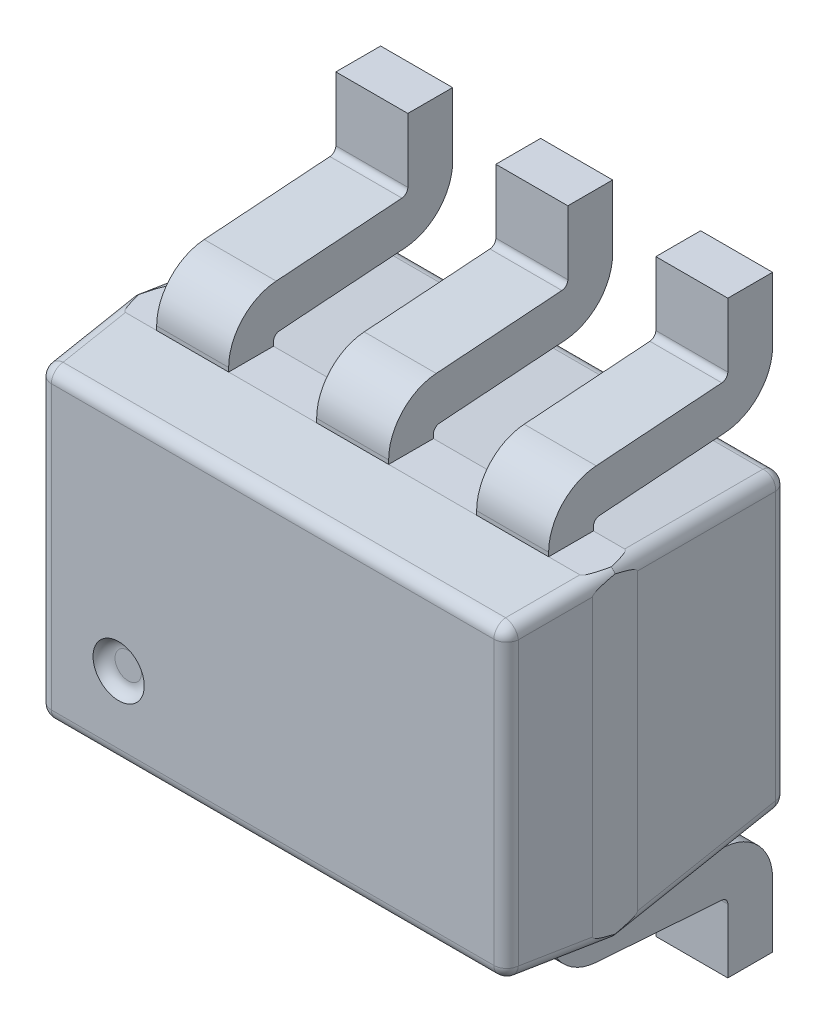
from build123d import *
from OCP.BRepFilletAPI import BRepFilletAPI_MakeChamfer

# Parameters (mm, degrees)
SALIENTE_EXTRUIR1_START = 0.05
CROQUIS1_W              = 1.5
CROQUIS1_H              = 1
SALIENTE_EXTRUIR1_DEPTH = 0.51
CHAFL_N1_SIZE           = 0.51
CHAFL_N1_SIZE_2         = 0.044619218
CROQUIS2_W              = 1.5
CROQUIS2_H              = 1
SALIENTE_EXTRUIR2_DEPTH = 0.39
CHAFL_N2_SIZE           = 0.25
CHAFL_N2_SIZE2          = 0.021872166
REDONDEO1_R             = 0.04
EXTRUIR_L_MINA1_DEPTH   = 0.1125
MATRIZL2_COUNT          = 2
MATRIZL2_PITCH          = 0.5
MATRIZL2_COL_COUNT      = 2
MATRIZL2_COL_PITCH      = 0.5
SIMETR_A2_COPY_1_DEPTH  = 0.1125
SIMETR_A2_COPY_2_DEPTH  = 0.1125
CROQUIS7_W              = 0.7
CROQUIS7_H              = 0.42
CORTAR_EXTRUIR1_DEPTH   = 0.225
CROQUIS8_R              = 0.08
CORTAR_EXTRUIR3_DEPTH   = 0.03
REDONDEO2_R             = 0.04


with BuildPart() as part:
    # Croquis1 → Saliente-Extruir1 (new body)
    with BuildSketch(Plane.XY.offset(SALIENTE_EXTRUIR1_START)):
        Rectangle(CROQUIS1_W, CROQUIS1_H)
    extrude(amount=SALIENTE_EXTRUIR1_DEPTH)

    # Chaflán1
    # the kernel refuses this chamfer: 0.51, 0.044619218 mm, written as the material it takes off along each edge
    with BuildSketch(Plane(origin=(2.075813381, 0.5, 0.05), x_dir=(0, 0, 1), z_dir=(-1, 0, 0)), Plane(origin=(-2.075813381, -0.5, 0.05), x_dir=(0, 0, 1), z_dir=(1, 0, 0))) as chafl_n1_piece_1:
        Polygon((CHAFL_N1_SIZE, 0), (0, -CHAFL_N1_SIZE_2 * 1.00000000892), (0, 0), align=None)
    extrude(amount=4.151626761, mode=Mode.SUBTRACT)
    with BuildSketch(Plane(origin=(-0.75, 1.825813381, 0.05), x_dir=(0, 0, 1), z_dir=(0, -1, 0)), Plane(origin=(0.75, -1.825813381, 0.05), x_dir=(0, 0, 1), z_dir=(0, 1, 0))) as chafl_n1_piece_2:
        Polygon((CHAFL_N1_SIZE, 0), (0, -CHAFL_N1_SIZE_2 * 1.00000000892), (0, 0), align=None)
    extrude(amount=3.651626761, mode=Mode.SUBTRACT)

    # Croquis2 → Saliente-Extruir2 (add)
    with BuildSketch(Plane.XY.offset(0.56)):
        Rectangle(CROQUIS2_W, CROQUIS2_H)
    extrude(amount=SALIENTE_EXTRUIR2_DEPTH)

    # Chaflán2: one chamfer whose edges measure the first distance from different faces: ONE call of the kernel's chamfer builder (chamfer() names one face for all edges)
    chafl_n2_edges_1 = [part.edges().sort_by_distance(p)[0] for p in [
        (0.75, 0, 0.95),
    ]]
    chafl_n2_side_1 = [part.faces().sort_by_distance(p)[0] for p in [
        (0.75, 0, 0.755),
    ]]
    chafl_n2_edges_2 = [part.edges().sort_by_distance(p)[0] for p in [
        (0, 0.5, 0.95),
    ]]
    chafl_n2_side_2 = [part.faces().sort_by_distance(p)[0] for p in [
        (0, 0.5, 0.755),
    ]]
    chafl_n2_edges_3 = [part.edges().sort_by_distance(p)[0] for p in [
        (-0.75, 0, 0.95),
    ]]
    chafl_n2_side_3 = [part.faces().sort_by_distance(p)[0] for p in [
        (-0.75, 0, 0.755),
    ]]
    chafl_n2_edges_4 = [part.edges().sort_by_distance(p)[0] for p in [
        (0, -0.5, 0.95),
    ]]
    chafl_n2_side_4 = [part.faces().sort_by_distance(p)[0] for p in [
        (0, -0.5, 0.755),
    ]]
    chafl_n2 = BRepFilletAPI_MakeChamfer(part.part.solid().wrapped)
    for e in chafl_n2_edges_1:
        chafl_n2.Add(CHAFL_N2_SIZE, CHAFL_N2_SIZE2, e.wrapped, chafl_n2_side_1[0].wrapped)  # the first distance lies on this face
    for e in chafl_n2_edges_2:
        chafl_n2.Add(CHAFL_N2_SIZE, CHAFL_N2_SIZE2, e.wrapped, chafl_n2_side_2[0].wrapped)  # the first distance lies on this face
    for e in chafl_n2_edges_3:
        chafl_n2.Add(CHAFL_N2_SIZE, CHAFL_N2_SIZE2, e.wrapped, chafl_n2_side_3[0].wrapped)  # the first distance lies on this face
    for e in chafl_n2_edges_4:
        chafl_n2.Add(CHAFL_N2_SIZE, CHAFL_N2_SIZE2, e.wrapped, chafl_n2_side_4[0].wrapped)  # the first distance lies on this face
    add(Compound.cast(chafl_n2.Shape()), mode=Mode.REPLACE)

    # Redondeo1
    # the kernel refuses this fillet: 0.04 mm, written as the material it takes off along each edge
    with BuildSketch(Plane(origin=(0.668727535, 0.418727535, 0.09), x_dir=(-0.7071067811865475, 0.7071067811865475, 0), z_dir=(0.5431604763461051, 0.5431604763461051, -0.6402760294364802))) as redondeo1_piece_1_section:
        Polygon((-0.0785695, -0.0785695), (0.0785695, -0.0785695), (0.0785695, 0.0785695), (-0.0785695, 0.0785695), align=None)
    redondeo1_piece_1 = extrude(amount=0.0785695, mode=Mode.PRIVATE)
    redondeo1_piece_1 = split(redondeo1_piece_1, bisect_by=Plane(origin=(0.668727535, 0.418727535, 0.09), z_dir=(0, 1, 0)), keep=Keep.TOP, mode=Mode.PRIVATE)
    redondeo1_piece_1 = split(redondeo1_piece_1, bisect_by=Plane(origin=(0.668727535, 0.418727535, 0.09), z_dir=(-0.08682659386383014, -0.08682659386383014, -0.9924325091390401)), keep=Keep.TOP, mode=Mode.PRIVATE)
    redondeo1_piece_1 = split(redondeo1_piece_1, bisect_by=Plane(origin=(0.668727535, 0.418727535, 0.09), z_dir=(1, 0, 0)), keep=Keep.TOP, mode=Mode.PRIVATE)
    redondeo1_piece_1 = split(redondeo1_piece_1, bisect_by=Plane(origin=(0.668727535, 0.418727535, 0.05), z_dir=(0, 0, 1)), keep=Keep.TOP, mode=Mode.PRIVATE)
    redondeo1_piece_1 = split(redondeo1_piece_1, bisect_by=Plane(origin=(0.708575323, 0.418727535, 0.08651377), z_dir=(-0.9961946980917825, 0, 0.08715574274723596)), keep=Keep.TOP, mode=Mode.PRIVATE)
    redondeo1_piece_1 = split(redondeo1_piece_1, bisect_by=Plane(origin=(0.668727535, 0.458575323, 0.08651377), z_dir=(0, -0.9961946980917825, 0.08715574274723596)), keep=Keep.TOP, mode=Mode.PRIVATE)
    redondeo1_piece_1 = redondeo1_piece_1 - Plane(origin=(0.668727535, 0.418727535, 0.09), x_dir=(-0.5431604763461051, -0.5431604763461051, 0.6402760294364802), z_dir=(-0.7071067811865475, 0.7071067811865475, 0)) * Sphere(REDONDEO1_R, mode=Mode.PRIVATE)
    add(redondeo1_piece_1, mode=Mode.SUBTRACT)
    with BuildSketch(Plane(origin=(-0.668727535, 0.418727535, 0.09), x_dir=(-0.7071067811865475, -0.7071067811865475, 0), z_dir=(-0.5431604763461051, 0.5431604763461051, -0.6402760294364802))) as redondeo1_piece_2_section:
        Polygon((-0.0785695, -0.0785695), (0.0785695, -0.0785695), (0.0785695, 0.0785695), (-0.0785695, 0.0785695), align=None)
    redondeo1_piece_2 = extrude(amount=0.0785695, mode=Mode.PRIVATE)
    redondeo1_piece_2 = split(redondeo1_piece_2, bisect_by=Plane(origin=(-0.668727535, 0.418727535, 0.09), z_dir=(-1, 0, 0)), keep=Keep.TOP, mode=Mode.PRIVATE)
    redondeo1_piece_2 = split(redondeo1_piece_2, bisect_by=Plane(origin=(-0.668727535, 0.418727535, 0.09), z_dir=(0.08682659386383014, -0.08682659386383014, -0.9924325091390401)), keep=Keep.TOP, mode=Mode.PRIVATE)
    redondeo1_piece_2 = split(redondeo1_piece_2, bisect_by=Plane(origin=(-0.668727535, 0.418727535, 0.09), z_dir=(0, 1, 0)), keep=Keep.TOP, mode=Mode.PRIVATE)
    redondeo1_piece_2 = split(redondeo1_piece_2, bisect_by=Plane(origin=(-0.668727535, 0.418727535, 0.05), z_dir=(0, 0, 1)), keep=Keep.TOP, mode=Mode.PRIVATE)
    redondeo1_piece_2 = split(redondeo1_piece_2, bisect_by=Plane(origin=(-0.668727535, 0.458575323, 0.08651377), z_dir=(0, -0.9961946980917825, 0.08715574274723596)), keep=Keep.TOP, mode=Mode.PRIVATE)
    redondeo1_piece_2 = split(redondeo1_piece_2, bisect_by=Plane(origin=(-0.708575323, 0.418727535, 0.08651377), z_dir=(0.9961946980917825, 0, 0.08715574274723596)), keep=Keep.TOP, mode=Mode.PRIVATE)
    redondeo1_piece_2 = redondeo1_piece_2 - Plane(origin=(-0.668727535, 0.418727535, 0.09), x_dir=(0.5431604763461051, -0.5431604763461051, 0.6402760294364802), z_dir=(-0.7071067811865475, -0.7071067811865475, 0)) * Sphere(REDONDEO1_R, mode=Mode.PRIVATE)
    add(redondeo1_piece_2, mode=Mode.SUBTRACT)
    with BuildSketch(Plane(origin=(-0.668727535, -0.418727535, 0.09), x_dir=(0.7071067811865475, -0.7071067811865475, 0), z_dir=(-0.5431604763461051, -0.5431604763461051, -0.6402760294364802))) as redondeo1_piece_3_section:
        Polygon((-0.0785695, -0.0785695), (0.0785695, -0.0785695), (0.0785695, 0.0785695), (-0.0785695, 0.0785695), align=None)
    redondeo1_piece_3 = extrude(amount=0.0785695, mode=Mode.PRIVATE)
    redondeo1_piece_3 = split(redondeo1_piece_3, bisect_by=Plane(origin=(-0.668727535, -0.418727535, 0.09), z_dir=(-1, 0, 0)), keep=Keep.TOP, mode=Mode.PRIVATE)
    redondeo1_piece_3 = split(redondeo1_piece_3, bisect_by=Plane(origin=(-0.668727535, -0.418727535, 0.09), z_dir=(0.08682659386383014, 0.08682659386383014, -0.9924325091390401)), keep=Keep.TOP, mode=Mode.PRIVATE)
    redondeo1_piece_3 = split(redondeo1_piece_3, bisect_by=Plane(origin=(-0.668727535, -0.418727535, 0.09), z_dir=(0, -1, 0)), keep=Keep.TOP, mode=Mode.PRIVATE)
    redondeo1_piece_3 = split(redondeo1_piece_3, bisect_by=Plane(origin=(-0.668727535, -0.418727535, 0.05), z_dir=(0, 0, 1)), keep=Keep.TOP, mode=Mode.PRIVATE)
    redondeo1_piece_3 = split(redondeo1_piece_3, bisect_by=Plane(origin=(-0.668727535, -0.458575323, 0.08651377), z_dir=(0, 0.9961946980917825, 0.08715574274723596)), keep=Keep.TOP, mode=Mode.PRIVATE)
    redondeo1_piece_3 = split(redondeo1_piece_3, bisect_by=Plane(origin=(-0.708575323, -0.418727535, 0.08651377), z_dir=(0.9961946980917825, 0, 0.08715574274723596)), keep=Keep.TOP, mode=Mode.PRIVATE)
    redondeo1_piece_3 = redondeo1_piece_3 - Plane(origin=(-0.668727535, -0.418727535, 0.09), x_dir=(0.5431604763461051, 0.5431604763461051, 0.6402760294364802), z_dir=(0.7071067811865475, -0.7071067811865475, 0)) * Sphere(REDONDEO1_R, mode=Mode.PRIVATE)
    add(redondeo1_piece_3, mode=Mode.SUBTRACT)
    with BuildSketch(Plane(origin=(0.668727535, -0.418727535, 0.09), x_dir=(0.05900350758257069, -0.7359928340769734, 0.6744131777184507), z_dir=(0.5431604763461051, -0.5431604763461051, -0.6402760294364802))) as redondeo1_piece_4_section:
        Polygon((-0.0785695, -0.0785695), (0.0785695, -0.0785695), (0.0785695, 0.0785695), (-0.0785695, 0.0785695), align=None)
    redondeo1_piece_4 = extrude(amount=0.0785695, mode=Mode.PRIVATE)
    redondeo1_piece_4 = split(redondeo1_piece_4, bisect_by=Plane(origin=(0.668727535, -0.418727535, 0.09), z_dir=(0, -1, 0)), keep=Keep.TOP, mode=Mode.PRIVATE)
    redondeo1_piece_4 = split(redondeo1_piece_4, bisect_by=Plane(origin=(0.668727535, -0.418727535, 0.09), z_dir=(1, 0, 0)), keep=Keep.TOP, mode=Mode.PRIVATE)
    redondeo1_piece_4 = split(redondeo1_piece_4, bisect_by=Plane(origin=(0.668727535, -0.418727535, 0.09), z_dir=(-0.08682659386383014, 0.08682659386383014, -0.9924325091390401)), keep=Keep.TOP, mode=Mode.PRIVATE)
    redondeo1_piece_4 = split(redondeo1_piece_4, bisect_by=Plane(origin=(0.708575323, -0.418727535, 0.08651377), z_dir=(-0.9961946980917825, 0, 0.08715574274723596)), keep=Keep.TOP, mode=Mode.PRIVATE)
    redondeo1_piece_4 = split(redondeo1_piece_4, bisect_by=Plane(origin=(0.668727535, -0.418727535, 0.05), z_dir=(0, 0, 1)), keep=Keep.TOP, mode=Mode.PRIVATE)
    redondeo1_piece_4 = split(redondeo1_piece_4, bisect_by=Plane(origin=(0.668727535, -0.458575323, 0.08651377), z_dir=(0, 0.9961946980917825, 0.08715574274723596)), keep=Keep.TOP, mode=Mode.PRIVATE)
    redondeo1_piece_4 = redondeo1_piece_4 - Plane(origin=(0.668727535, -0.418727535, 0.09), x_dir=(-0.5431604763461051, 0.5431604763461051, 0.6402760294364802), z_dir=(0.05900350758257069, -0.7359928340769734, 0.6744131777184507)) * Sphere(REDONDEO1_R, mode=Mode.PRIVATE)
    add(redondeo1_piece_4, mode=Mode.SUBTRACT)
    with BuildSketch(Plane(origin=(0.691474587, -0.441474587, 0.91), x_dir=(-0.7071067811865476, -0.7071067811865476, 0), z_dir=(0.5431604763459367, -0.5431604763459367, 0.640276029436766))) as redondeo1_piece_5_section:
        Polygon((-0.0785695, -0.0785695), (0.0785695, -0.0785695), (0.0785695, 0.0785695), (-0.0785695, 0.0785695), align=None)
    redondeo1_piece_5 = extrude(amount=0.0785695, mode=Mode.PRIVATE)
    redondeo1_piece_5 = split(redondeo1_piece_5, bisect_by=Plane(origin=(0.691474587, -0.441474587, 0.91), z_dir=(0, -1, 0)), keep=Keep.TOP, mode=Mode.PRIVATE)
    redondeo1_piece_5 = split(redondeo1_piece_5, bisect_by=Plane(origin=(0.691474587, -0.441474587, 0.91), z_dir=(-0.08682659386424758, 0.0868265938642478, 0.9924325091389671)), keep=Keep.TOP, mode=Mode.PRIVATE)
    redondeo1_piece_5 = split(redondeo1_piece_5, bisect_by=Plane(origin=(0.691474587, -0.441474587, 0.91), z_dir=(1, 0, 0)), keep=Keep.TOP, mode=Mode.PRIVATE)
    redondeo1_piece_5 = split(redondeo1_piece_5, bisect_by=Plane(origin=(0.691474587, -0.441474587, 0.95), z_dir=(0, 0, -1)), keep=Keep.TOP, mode=Mode.PRIVATE)
    redondeo1_piece_5 = split(redondeo1_piece_5, bisect_by=Plane(origin=(0.731322375, -0.441474587, 0.91348623), z_dir=(-0.9961946980917455, 0, -0.08715574274765817)), keep=Keep.TOP, mode=Mode.PRIVATE)
    redondeo1_piece_5 = split(redondeo1_piece_5, bisect_by=Plane(origin=(0.691474587, -0.481322375, 0.91348623), z_dir=(0, 0.9961946980917455, -0.08715574274765839)), keep=Keep.TOP, mode=Mode.PRIVATE)
    redondeo1_piece_5 = redondeo1_piece_5 - Plane(origin=(0.691474587, -0.441474587, 0.91), x_dir=(-0.5431604763459367, 0.5431604763459367, -0.640276029436766), z_dir=(-0.7071067811865476, -0.7071067811865476, 0)) * Sphere(REDONDEO1_R, mode=Mode.PRIVATE)
    add(redondeo1_piece_5, mode=Mode.SUBTRACT)
    with BuildSketch(Plane(origin=(0.691474587, 0.441474587, 0.91), x_dir=(0.7071067811865476, -0.7071067811865476, 0), z_dir=(0.5431604763459367, 0.5431604763459367, 0.640276029436766))) as redondeo1_piece_6_section:
        Polygon((-0.0785695, -0.0785695), (0.0785695, -0.0785695), (0.0785695, 0.0785695), (-0.0785695, 0.0785695), align=None)
    redondeo1_piece_6 = extrude(amount=0.0785695, mode=Mode.PRIVATE)
    redondeo1_piece_6 = split(redondeo1_piece_6, bisect_by=Plane(origin=(0.691474587, 0.441474587, 0.91), z_dir=(0, 1, 0)), keep=Keep.TOP, mode=Mode.PRIVATE)
    redondeo1_piece_6 = split(redondeo1_piece_6, bisect_by=Plane(origin=(0.691474587, 0.441474587, 0.91), z_dir=(-0.08682659386424758, -0.0868265938642478, 0.9924325091389671)), keep=Keep.TOP, mode=Mode.PRIVATE)
    redondeo1_piece_6 = split(redondeo1_piece_6, bisect_by=Plane(origin=(0.691474587, 0.441474587, 0.91), z_dir=(1, 0, 0)), keep=Keep.TOP, mode=Mode.PRIVATE)
    redondeo1_piece_6 = split(redondeo1_piece_6, bisect_by=Plane(origin=(0.691474587, 0.441474587, 0.95), z_dir=(0, 0, -1)), keep=Keep.TOP, mode=Mode.PRIVATE)
    redondeo1_piece_6 = split(redondeo1_piece_6, bisect_by=Plane(origin=(0.731322375, 0.441474587, 0.91348623), z_dir=(-0.9961946980917455, 0, -0.08715574274765817)), keep=Keep.TOP, mode=Mode.PRIVATE)
    redondeo1_piece_6 = split(redondeo1_piece_6, bisect_by=Plane(origin=(0.691474587, 0.481322375, 0.91348623), z_dir=(0, -0.9961946980917455, -0.08715574274765839)), keep=Keep.TOP, mode=Mode.PRIVATE)
    redondeo1_piece_6 = redondeo1_piece_6 - Plane(origin=(0.691474587, 0.441474587, 0.91), x_dir=(-0.5431604763459367, -0.5431604763459367, -0.640276029436766), z_dir=(0.7071067811865476, -0.7071067811865476, 0)) * Sphere(REDONDEO1_R, mode=Mode.PRIVATE)
    add(redondeo1_piece_6, mode=Mode.SUBTRACT)
    with BuildSketch(Plane(origin=(-0.691474587, -0.441474587, 0.91), x_dir=(-0.7071067811865476, 0.7071067811865476, 0), z_dir=(-0.5431604763459367, -0.5431604763459367, 0.640276029436766))) as redondeo1_piece_7_section:
        Polygon((-0.0785695, -0.0785695), (0.0785695, -0.0785695), (0.0785695, 0.0785695), (-0.0785695, 0.0785695), align=None)
    redondeo1_piece_7 = extrude(amount=0.0785695, mode=Mode.PRIVATE)
    redondeo1_piece_7 = split(redondeo1_piece_7, bisect_by=Plane(origin=(-0.691474587, -0.441474587, 0.91), z_dir=(-1, 0, 0)), keep=Keep.TOP, mode=Mode.PRIVATE)
    redondeo1_piece_7 = split(redondeo1_piece_7, bisect_by=Plane(origin=(-0.691474587, -0.441474587, 0.91), z_dir=(0.08682659386424758, 0.0868265938642478, 0.9924325091389671)), keep=Keep.TOP, mode=Mode.PRIVATE)
    redondeo1_piece_7 = split(redondeo1_piece_7, bisect_by=Plane(origin=(-0.691474587, -0.441474587, 0.91), z_dir=(0, -1, 0)), keep=Keep.TOP, mode=Mode.PRIVATE)
    redondeo1_piece_7 = split(redondeo1_piece_7, bisect_by=Plane(origin=(-0.691474587, -0.441474587, 0.95), z_dir=(0, 0, -1)), keep=Keep.TOP, mode=Mode.PRIVATE)
    redondeo1_piece_7 = split(redondeo1_piece_7, bisect_by=Plane(origin=(-0.691474587, -0.481322375, 0.91348623), z_dir=(0, 0.9961946980917455, -0.08715574274765839)), keep=Keep.TOP, mode=Mode.PRIVATE)
    redondeo1_piece_7 = split(redondeo1_piece_7, bisect_by=Plane(origin=(-0.731322375, -0.441474587, 0.91348623), z_dir=(0.9961946980917455, 0, -0.08715574274765817)), keep=Keep.TOP, mode=Mode.PRIVATE)
    redondeo1_piece_7 = redondeo1_piece_7 - Plane(origin=(-0.691474587, -0.441474587, 0.91), x_dir=(0.5431604763459367, 0.5431604763459367, -0.640276029436766), z_dir=(-0.7071067811865476, 0.7071067811865476, 0)) * Sphere(REDONDEO1_R, mode=Mode.PRIVATE)
    add(redondeo1_piece_7, mode=Mode.SUBTRACT)
    with BuildSketch(Plane(origin=(-0.691474587, 0.441474587, 0.91), x_dir=(0.7071067811865476, 0.7071067811865476, 0), z_dir=(-0.5431604763459367, 0.5431604763459367, 0.640276029436766))) as redondeo1_piece_8_section:
        Polygon((-0.0785695, -0.0785695), (0.0785695, -0.0785695), (0.0785695, 0.0785695), (-0.0785695, 0.0785695), align=None)
    redondeo1_piece_8 = extrude(amount=0.0785695, mode=Mode.PRIVATE)
    redondeo1_piece_8 = split(redondeo1_piece_8, bisect_by=Plane(origin=(-0.691474587, 0.441474587, 0.91), z_dir=(-1, 0, 0)), keep=Keep.TOP, mode=Mode.PRIVATE)
    redondeo1_piece_8 = split(redondeo1_piece_8, bisect_by=Plane(origin=(-0.691474587, 0.441474587, 0.91), z_dir=(0.08682659386424758, -0.0868265938642478, 0.9924325091389671)), keep=Keep.TOP, mode=Mode.PRIVATE)
    redondeo1_piece_8 = split(redondeo1_piece_8, bisect_by=Plane(origin=(-0.691474587, 0.441474587, 0.91), z_dir=(0, 1, 0)), keep=Keep.TOP, mode=Mode.PRIVATE)
    redondeo1_piece_8 = split(redondeo1_piece_8, bisect_by=Plane(origin=(-0.691474587, 0.441474587, 0.95), z_dir=(0, 0, -1)), keep=Keep.TOP, mode=Mode.PRIVATE)
    redondeo1_piece_8 = split(redondeo1_piece_8, bisect_by=Plane(origin=(-0.691474587, 0.481322375, 0.91348623), z_dir=(0, -0.9961946980917455, -0.08715574274765839)), keep=Keep.TOP, mode=Mode.PRIVATE)
    redondeo1_piece_8 = split(redondeo1_piece_8, bisect_by=Plane(origin=(-0.731322375, 0.441474587, 0.91348623), z_dir=(0.9961946980917455, 0, -0.08715574274765817)), keep=Keep.TOP, mode=Mode.PRIVATE)
    redondeo1_piece_8 = redondeo1_piece_8 - Plane(origin=(-0.691474587, 0.441474587, 0.91), x_dir=(0.5431604763459367, -0.5431604763459367, -0.640276029436766), z_dir=(0.7071067811865476, 0.7071067811865476, 0)) * Sphere(REDONDEO1_R, mode=Mode.PRIVATE)
    add(redondeo1_piece_8, mode=Mode.SUBTRACT)
    with BuildSketch(Plane(origin=(0.668727535, 0.455380782, 0.05), x_dir=(0, -1, 0), z_dir=(-1, 0, 0))) as redondeo1_piece_9:
        with BuildLine():
            CenterArc((REDONDEO1_R * 0.916331174018, REDONDEO1_R), REDONDEO1_R, 185, 85)
            Line((-REDONDEO1_R * 0.079863524074, REDONDEO1_R * 0.912844257253), (0, 0))
            Line((0, 0), (REDONDEO1_R * 0.916331174018, 0))
        make_face()
    extrude(amount=1.337455069, mode=Mode.SUBTRACT)
    with BuildSketch(Plane(origin=(-0.705380782, 0.418727535, 0.05), x_dir=(-0.08715574274723663, 0, 0.9961946980917824), z_dir=(0, -1, 0))) as redondeo1_piece_10:
        with BuildLine():
            CenterArc((REDONDEO1_R * 0.916331174018, -REDONDEO1_R), REDONDEO1_R, 90, 85)
            Line((-REDONDEO1_R * 0.079863524074, -REDONDEO1_R * 0.912844257253), (0, 0))
            Line((0, 0), (REDONDEO1_R * 0.916331174018, 0))
        make_face()
    extrude(amount=0.837455069, mode=Mode.SUBTRACT)
    with BuildSketch(Plane(origin=(-0.668727535, -0.455380782, 0.05), x_dir=(0, -0.08715574274723376, 0.9961946980917826), z_dir=(1, 0, 0))) as redondeo1_piece_11:
        with BuildLine():
            CenterArc((REDONDEO1_R * 0.916331174018, -REDONDEO1_R), REDONDEO1_R, 90, 85)
            Line((-REDONDEO1_R * 0.079863524074, -REDONDEO1_R * 0.912844257253), (0, 0))
            Line((0, 0), (REDONDEO1_R * 0.916331174018, 0))
        make_face()
    extrude(amount=1.337455069, mode=Mode.SUBTRACT)
    with BuildSketch(Plane(origin=(0.705380782, -0.418727535, 0.05), x_dir=(-1, 0, 0), z_dir=(0, 1, 0))) as redondeo1_piece_12:
        with BuildLine():
            CenterArc((REDONDEO1_R * 0.916331174018, REDONDEO1_R), REDONDEO1_R, 185, 85)
            Line((-REDONDEO1_R * 0.079863524074, REDONDEO1_R * 0.912844257253), (0, 0))
            Line((0, 0), (REDONDEO1_R * 0.916331174018, 0))
        make_face()
    extrude(amount=0.837455069, mode=Mode.SUBTRACT)
    with BuildSketch(Plane(origin=(0.728127834, -0.441474587, 0.95), x_dir=(-1, 0, 0), z_dir=(0, 1, 0))) as redondeo1_piece_13:
        with BuildLine():
            CenterArc((REDONDEO1_R * 0.916331174017, -REDONDEO1_R), REDONDEO1_R, 90, 85)
            Line((-REDONDEO1_R * 0.0798635240743, -REDONDEO1_R * 0.912844257252), (0, 0))
            Line((0, 0), (REDONDEO1_R * 0.916331174017, 0))
        make_face()
    extrude(amount=0.882949174, mode=Mode.SUBTRACT)
    with BuildSketch(Plane(origin=(-0.691474587, -0.478127834, 0.95), x_dir=(0, -0.08715574274765722, -0.9961946980917455), z_dir=(1, 0, 0))) as redondeo1_piece_14:
        with BuildLine():
            CenterArc((REDONDEO1_R * 0.916331174017, REDONDEO1_R), REDONDEO1_R, 185, 85)
            Line((-REDONDEO1_R * 0.0798635240743, REDONDEO1_R * 0.912844257252), (0, 0))
            Line((0, 0), (REDONDEO1_R * 0.916331174017, 0))
        make_face()
    extrude(amount=1.382949174, mode=Mode.SUBTRACT)
    with BuildSketch(Plane(origin=(-0.728127834, 0.441474587, 0.95), x_dir=(-0.08715574274765572, 0, -0.9961946980917458), z_dir=(0, -1, 0))) as redondeo1_piece_15:
        with BuildLine():
            CenterArc((REDONDEO1_R * 0.916331174017, REDONDEO1_R), REDONDEO1_R, 185, 85)
            Line((-REDONDEO1_R * 0.0798635240743, REDONDEO1_R * 0.912844257252), (0, 0))
            Line((0, 0), (REDONDEO1_R * 0.916331174017, 0))
        make_face()
    extrude(amount=0.882949174, mode=Mode.SUBTRACT)
    with BuildSketch(Plane(origin=(0.691474587, 0.478127834, 0.95), x_dir=(0, -1, 0), z_dir=(-1, 0, 0))) as redondeo1_piece_16:
        with BuildLine():
            CenterArc((REDONDEO1_R * 0.916331174017, -REDONDEO1_R), REDONDEO1_R, 90, 85)
            Line((-REDONDEO1_R * 0.0798635240743, -REDONDEO1_R * 0.912844257252), (0, 0))
            Line((0, 0), (REDONDEO1_R * 0.916331174017, 0))
        make_face()
    extrude(amount=1.382949174, mode=Mode.SUBTRACT)
    with BuildSketch(Plane(origin=(0.708274916, -0.458274916, 0.083080105), x_dir=(-0.9962234400966511, -0.007567436278419918, 0.08649619246051563), z_dir=(0.08682659386383014, -0.08682659386383014, 0.9924325091390401)), Plane(origin=(-0.793084767, -0.543084767, 1.052461143), x_dir=(0.9962234400966509, -0.007567436278417262, 0.08649619246051585), z_dir=(0.08682659386383014, 0.08682659386383014, -0.9924325091390401))) as redondeo1_piece_17:
        with BuildLine():
            CenterArc((REDONDEO1_R * 0.992432509139, -REDONDEO1_R), REDONDEO1_R, 90, 89.564769998)
            Line((-REDONDEO1_R * 0.00753863989871, -REDONDEO1_R * 0.992403876506), (0, 0))
            Line((0, 0), (REDONDEO1_R * 0.992432509139, 0))
        make_face()
    extrude(amount=0.976772757, mode=Mode.SUBTRACT)
    with BuildSketch(Plane(origin=(0.793084767, -0.543084767, 0.207538857), x_dir=(-0.9962234400966146, -0.00756743627848758, -0.08649619246092874), z_dir=(-0.08682659386424758, 0.0868265938642478, 0.9924325091389671)), Plane(origin=(0.793084767, 0.543084767, 0.207538857), x_dir=(0.0075674362784876, -0.9962234400966146, -0.08649619246092896), z_dir=(-0.08682659386424758, -0.0868265938642478, 0.9924325091389671))) as redondeo1_piece_18:
        with BuildLine():
            CenterArc((REDONDEO1_R * 0.992432509139, -REDONDEO1_R), REDONDEO1_R, 90, 89.564769998)
            Line((-REDONDEO1_R * 0.00753863989878, -REDONDEO1_R * 0.992403876506), (0, 0))
            Line((0, 0), (REDONDEO1_R * 0.992432509139, 0))
        make_face()
    extrude(amount=0.714790206, mode=Mode.SUBTRACT)
    with BuildSketch(Plane(origin=(0.793084767, 0.543084767, 1.052461143), x_dir=(0.007567436278419553, -0.9962234400966511, 0.08649619246051567), z_dir=(-0.08682659386383014, -0.08682659386383014, -0.9924325091390401)), Plane(origin=(-0.708274916, 0.458274916, 0.083080105), x_dir=(-0.0075674362784114695, -0.9962234400966509, 0.08649619246051636), z_dir=(-0.08682659386383014, 0.08682659386383014, 0.9924325091390401))) as redondeo1_piece_19:
        with BuildLine():
            CenterArc((REDONDEO1_R * 0.992432509139, REDONDEO1_R), REDONDEO1_R, 180.435230002, 89.564769998)
            Line((-REDONDEO1_R * 0.00753863989871, REDONDEO1_R * 0.992403876506), (0, 0))
            Line((0, 0), (REDONDEO1_R * 0.992432509139, 0))
        make_face()
    extrude(amount=0.976772757, mode=Mode.SUBTRACT)
    with BuildSketch(Plane(origin=(-0.793084767, 0.543084767, 0.207538857), x_dir=(-0.007567436278484824, -0.9962234400966146, -0.0864961924609292), z_dir=(0.08682659386424758, -0.0868265938642478, 0.9924325091389671)), Plane(origin=(-0.793084767, -0.543084767, 0.207538857), x_dir=(0.9962234400966146, -0.00756743627848758, -0.08649619246092874), z_dir=(0.08682659386424758, 0.0868265938642478, 0.9924325091389671))) as redondeo1_piece_20:
        with BuildLine():
            CenterArc((REDONDEO1_R * 0.992432509139, REDONDEO1_R), REDONDEO1_R, 180.435230002, 89.564769998)
            Line((-REDONDEO1_R * 0.00753863989877, REDONDEO1_R * 0.992403876506), (0, 0))
            Line((0, 0), (REDONDEO1_R * 0.992432509139, 0))
        make_face()
    extrude(amount=0.714790206, mode=Mode.SUBTRACT)

    # Croquis4 → Extruir-Lámina1 (add, symmetric)
    with BuildSketch(Plane(origin=(0, 0, 0), x_dir=(0, 0, -1), z_dir=(1, 0, 0))):
        with BuildLine():
            Line((-0.56, -0.495), (-0.56, -0.512398543))
            ThreePointArc((-0.56, -0.512398543), (-0.554637261, -0.526027578), (-0.541424941, -0.532347717))
            Line((-0.541424941, -0.532347717), (-0.148600472, -0.560406608))
            ThreePointArc((-0.148600472, -0.560406608), (-0.042901912, -0.610967721), (0, -0.72))
            Line((0, -0.72), (0, -0.92))
            Line((0, -0.92), (-0.14, -0.92))
            Line((-0.14, -0.92), (-0.14, -0.72))
            ThreePointArc((-0.14, -0.72), (-0.145362739, -0.706370965), (-0.158575059, -0.700050826))
            Line((-0.158575059, -0.700050826), (-0.551399528, -0.671991935))
            ThreePointArc((-0.551399528, -0.671991935), (-0.657098088, -0.621430822), (-0.7, -0.512398543))
            Line((-0.7, -0.512398543), (-0.7, -0.495))
            Line((-0.7, -0.495), (-0.56, -0.495))
        make_face()
    extruir_l_mina1 = extrude(amount=EXTRUIR_L_MINA1_DEPTH, both=True)

    # MatrizL2: Extruir-Lámina1 ×2
    with Locations(*[(i * MATRIZL2_PITCH, 0, 0) for i in range(1, MATRIZL2_COUNT)]):
        add(extruir_l_mina1)

    # MatrizL2 col: Extruir-Lámina1 ×2
    with Locations(*[(-i * MATRIZL2_COL_PITCH, 0, 0) for i in range(1, MATRIZL2_COL_COUNT)]):
        add(extruir_l_mina1)

    # Simetría2: Extruir-Lámina1 across plane
    add(extruir_l_mina1.mirror(Plane.ZX))

    # Simetría2 copy 1 sketch → Simetría2 copy 1 (add, symmetric)
    with BuildSketch(Plane(origin=(0.5, 0, 0), x_dir=(0, 0, -1), z_dir=(1, 0, 0))):
        with BuildLine():
            Line((-0.56, 0.495), (-0.56, 0.512398543))
            ThreePointArc((-0.56, 0.512398543), (-0.554637261, 0.526027578), (-0.541424941, 0.532347717))
            Line((-0.541424941, 0.532347717), (-0.148600472, 0.560406608))
            ThreePointArc((-0.148600472, 0.560406608), (-0.042901912, 0.610967721), (0, 0.72))
            Line((0, 0.72), (0, 0.92))
            Line((0, 0.92), (-0.14, 0.92))
            Line((-0.14, 0.92), (-0.14, 0.72))
            ThreePointArc((-0.14, 0.72), (-0.145362739, 0.706370965), (-0.158575059, 0.700050826))
            Line((-0.158575059, 0.700050826), (-0.551399528, 0.671991935))
            ThreePointArc((-0.551399528, 0.671991935), (-0.657098088, 0.621430822), (-0.7, 0.512398543))
            Line((-0.7, 0.512398543), (-0.7, 0.495))
            Line((-0.7, 0.495), (-0.56, 0.495))
        make_face()
    extrude(amount=SIMETR_A2_COPY_1_DEPTH, both=True)

    # Simetría2 copy 2 sketch → Simetría2 copy 2 (add, symmetric)
    with BuildSketch(Plane(origin=(-0.5, 0, 0), x_dir=(0, 0, -1), z_dir=(1, 0, 0))):
        with BuildLine():
            Line((-0.56, 0.495), (-0.56, 0.512398543))
            ThreePointArc((-0.56, 0.512398543), (-0.554637261, 0.526027578), (-0.541424941, 0.532347717))
            Line((-0.541424941, 0.532347717), (-0.148600472, 0.560406608))
            ThreePointArc((-0.148600472, 0.560406608), (-0.042901912, 0.610967721), (0, 0.72))
            Line((0, 0.72), (0, 0.92))
            Line((0, 0.92), (-0.14, 0.92))
            Line((-0.14, 0.92), (-0.14, 0.72))
            ThreePointArc((-0.14, 0.72), (-0.145362739, 0.706370965), (-0.158575059, 0.700050826))
            Line((-0.158575059, 0.700050826), (-0.551399528, 0.671991935))
            ThreePointArc((-0.551399528, 0.671991935), (-0.657098088, 0.621430822), (-0.7, 0.512398543))
            Line((-0.7, 0.512398543), (-0.7, 0.495))
            Line((-0.7, 0.495), (-0.56, 0.495))
        make_face()
    extrude(amount=SIMETR_A2_COPY_2_DEPTH, both=True)

    # Croquis7 → Cortar-Extruir1 (cut)
    with BuildSketch(Plane(origin=(0.1125, 0, 0), x_dir=(0, 0, -1), z_dir=(1, 0, 0))):
        with Locations((-0.35, 0.71)):
            Rectangle(CROQUIS7_W, CROQUIS7_H)
    extrude(amount=-CORTAR_EXTRUIR1_DEPTH, mode=Mode.SUBTRACT)

    # Croquis8 → Cortar-Extruir3 (cut)
    with BuildSketch(Plane.XY.offset(0.95)):
        with Locations((-0.481322375, -0.231322375)):
            Circle(CROQUIS8_R)
    extrude(amount=-CORTAR_EXTRUIR3_DEPTH, mode=Mode.SUBTRACT)

    # Redondeo2
    # the kernel refuses this fillet: 0.04 mm, written as the material it adds along each edge
    with BuildSketch(Plane(origin=(-0.481322375, -0.231322375, 0.92), x_dir=(1, 0, 0), z_dir=(0, -1, 0))) as redondeo2_piece_1:
        with BuildLine():
            CenterArc((0.041270167, 0.04), REDONDEO2_R, 270, 75.522487815)
            Line((0.041270167, 0), (0.041270167, -0.0008))
            Line((0.041270167, -0.0008), (0.08, -0.0008))
            Line((0.08, -0.0008), (0.0808, 0))
            ThreePointArc((0.0808, 0), (0.0808, 0.015), (0.080774597, 0.0298))
            Line((0.080774597, 0.0298), (0.08, 0.03))
        make_face()
    revolve(axis=Axis((-0.481322375, -0.231322375, 0.92), (0, 0, 1)))

    # Mirror1: Extruir-Lámina1 across plane
    add(extruir_l_mina1.mirror(Plane.ZX))


solid = part.part
